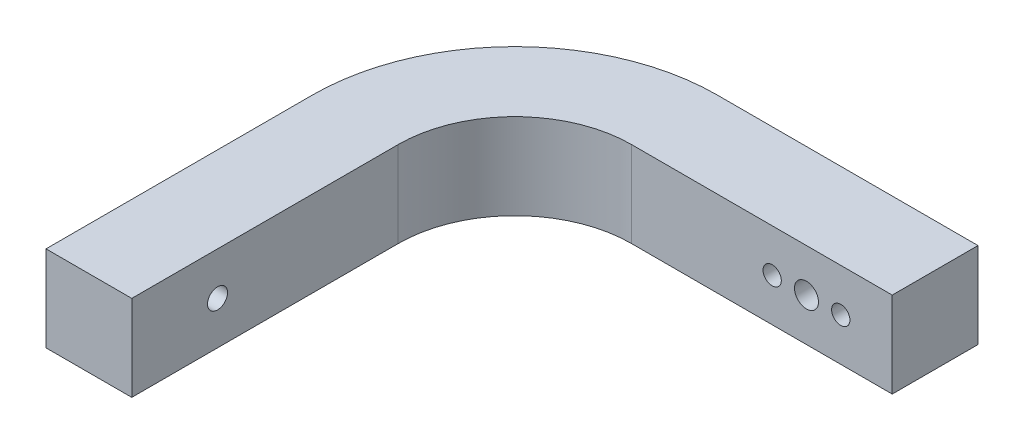
from build123d import *

# Parameters (mm, degrees)
BOSS_EXTRUDE1_DEPTH      = 7.5
BOSS_EXTRUDE1_DEPTH_BACK = 7.5
CUT_EXTRUDE1_DEPTH       = 106.528432188
CUT_EXTRUDE1_DEPTH_BACK  = 106.528432188
SKETCH2_R                = 1.75
SKETCH3_R                = 2.1
SKETCH3_R_2              = 1.6
CUT_EXTRUDE2_DEPTH       = 106.528432188
SKETCH4_R                = 2.275
CUT_EXTRUDE3_DEPTH       = 6
SKETCH5_R                = 3.825
CUT_EXTRUDE4_DEPTH       = 0.75


with BuildPart() as part:
    # Sketch1 → Boss-Extrude1 (new, two sides: drawn at the far end of the back side and taken through both)
    with BuildSketch(Plane(origin=(0, 0, 0), x_dir=(1, 0, 0), z_dir=(0, 1, 0)).offset(-BOSS_EXTRUDE1_DEPTH_BACK)):
        with BuildLine():
            Line((-66, -35.4), (-66, -82))
            Line((-66, -82), (-51, -82))
            Line((-51, -82), (-51, -35.4))
            ThreePointArc((-51, -35.4), (-45.024978336, -20.975021664), (-30.6, -15))
            Line((-30.6, -15), (15, -15))
            Line((15, -15), (15, 0))
            Line((15, 0), (-30.6, 0))
            ThreePointArc((-30.6, 0), (-55.631580054, -10.368419946), (-66, -35.4))
        make_face()
    extrude(amount=BOSS_EXTRUDE1_DEPTH + BOSS_EXTRUDE1_DEPTH_BACK)

    # Sketch2 → Cut-Extrude1 (cut, two sides: drawn at the far end of the back side and taken through both)
    with BuildSketch(Plane.ZY.offset(51).offset(-CUT_EXTRUDE1_DEPTH_BACK)):
        with Locations((67, 0)):
            Circle(SKETCH2_R)
    extrude(amount=CUT_EXTRUDE1_DEPTH + CUT_EXTRUDE1_DEPTH_BACK, mode=Mode.SUBTRACT)

    # Sketch3 → Cut-Extrude2 (cut, through all)
    with BuildSketch(Plane(origin=(0, 0, 0), x_dir=(-1, 0, 0), z_dir=(0, 0, -1))):
        Circle(SKETCH3_R)
        with Locations((-6, 0)):
            Circle(SKETCH3_R_2)
        with Locations((6, 0)):
            Circle(SKETCH3_R_2)
    extrude(amount=-CUT_EXTRUDE2_DEPTH, mode=Mode.SUBTRACT)

    # Sketch4 → Cut-Extrude3 (cut)
    with BuildSketch(Plane(origin=(-66, 0, 0), x_dir=(0, 0, -1), z_dir=(1, 0, 0))):
        with Locations((-67, 0)):
            Circle(SKETCH4_R)
    extrude(amount=CUT_EXTRUDE3_DEPTH, mode=Mode.SUBTRACT)

    # Sketch5 → Cut-Extrude4 (cut)
    with BuildSketch(Plane.ZY.offset(66)):
        with Locations((67, 0)):
            Circle(SKETCH5_R)
    extrude(amount=-CUT_EXTRUDE4_DEPTH, mode=Mode.SUBTRACT)


solid = part.part
